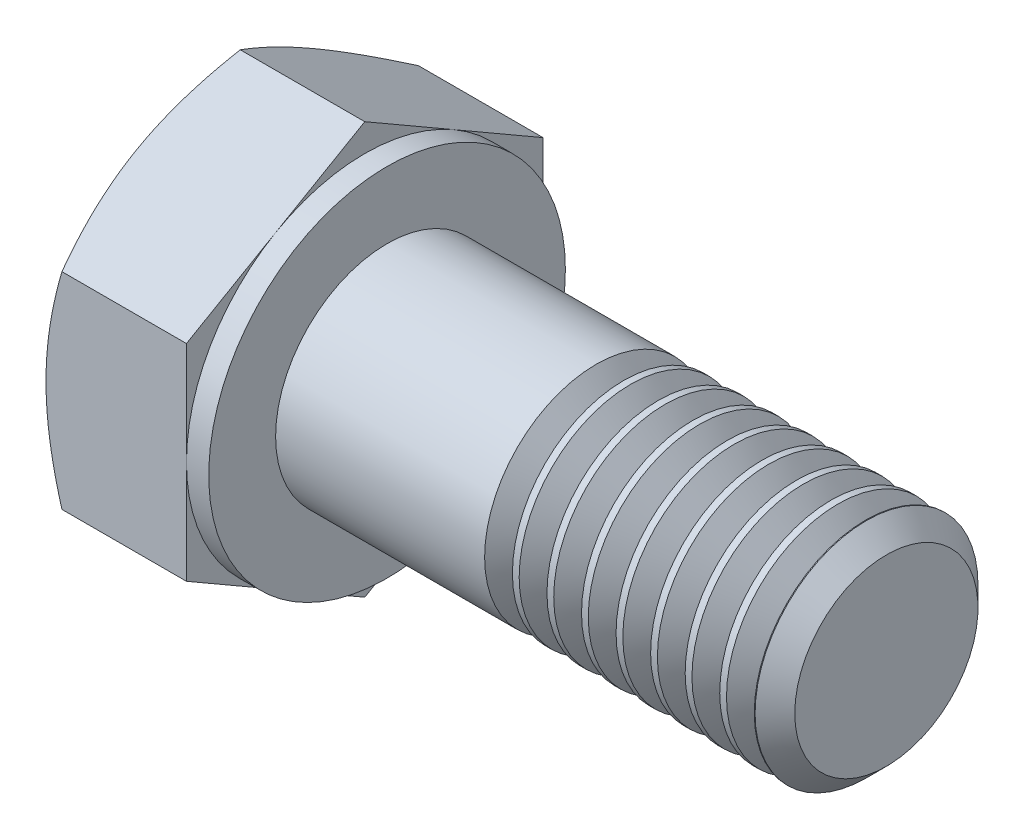
from build123d import *

# Parameters (mm, degrees)
BASEHEAD_DEPTH     = 3.65
INDENT_START       = -0.45625
INDENT_2_OUTLINE_R = 3.5
INDENT_2_DEPTH     = 0.45625
SKETCH4_W          = 0.5
SKETCH4_H          = 10.618802154
THDSCHPAT_COUNT    = 8
THDSCHPAT_PITCH    = 0.775


# Read off the part's stored shape, not the designer's step: Indent
with BuildPart() as part:
    # Sketch1 → BaseHead (new body)
    with BuildSketch(Plane(origin=(0, 0, 0), x_dir=(0, 0, -1), z_dir=(1, 0, 0))):
        Polygon((4, 2.309401077), (4, -2.309401077), (0, -4.618802154), (-4, -2.309401077), (-4, 2.309401077), (0, 4.618802154), align=None)
    extrude(amount=BASEHEAD_DEPTH)

    # Indent outline → Indent (revolve)
    with BuildSketch(Plane.YX):
        Polygon((2.5, 3.65), (2.5, 14.405), (2.055, 14.85), (0, 14.85), (0, 3.65), align=None)
    revolve(axis=Axis((0, 0, 0), (1, 0, 0)))

    # Indent 2 outline → Indent 2 (cut)
    with BuildSketch(Plane.ZY.offset(INDENT_START)):
        with Locations((0.033212245, 0.192376607)):
            Circle(INDENT_2_OUTLINE_R)
    extrude(amount=INDENT_2_DEPTH, mode=Mode.SUBTRACT)

    # Sketch3 → HeadChamfer (revolve, cut)
    with BuildSketch(Plane.XY, mode=Mode.PRIVATE) as headchamfer_sk:
        Polygon((0, 4), (3.244016936, 9.618802154), (3.244016936, 14.618802154), (-10, 14.618802154), (-10, 4), align=None)
    revolve(headchamfer_sk.sketch.rotate(Axis((0, 0, 0), (1, 0, 0)), 90), axis=Axis((0, 0, 0), (1, 0, 0)), mode=Mode.SUBTRACT)

    # Sketch4 → BearingFace (revolve, cut)
    with BuildSketch(Plane.XY, mode=Mode.PRIVATE) as bearingface_sk:
        with Locations((3.4, 9.309401077)):
            Rectangle(SKETCH4_W, SKETCH4_H)
    revolve(bearingface_sk.sketch.rotate(Axis((0, 0, 0), (1, 0, 0)), 90), axis=Axis((0, 0, 0), (1, 0, 0)), mode=Mode.SUBTRACT)

    # ThdSchSke → ThreadSchematic (revolve, cut)
    with BuildSketch(Plane.XY):
        Polygon((8.65, -2.055), (8.338407645, -2.5), (8.338407645, -3.125), (8.961592355, -3.125), (8.961592355, -2.5), align=None)
    threadschematic = revolve(axis=Axis((-3.175, 0, 0), (1, 0, 0)), mode=Mode.SUBTRACT)

    # ThdSchPat: ThreadSchematic ×8
    with Locations(*[(i * THDSCHPAT_PITCH, 0, 0) for i in range(1, THDSCHPAT_COUNT)]):
        add(threadschematic, mode=Mode.SUBTRACT)


solid = part.part
